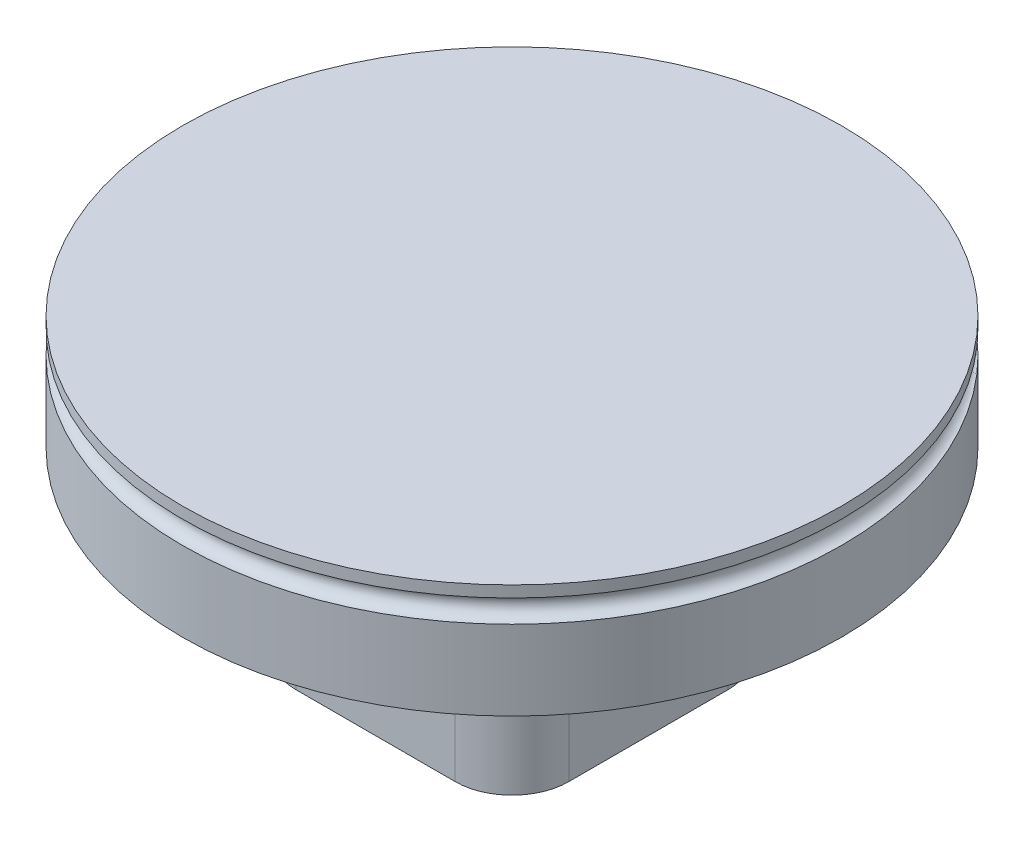
from build123d import *

# Parameters (mm, degrees)
SKETCH1_R           = 29
BOSS_EXTRUDE1_DEPTH = 10
SKETCH2_W           = 24
SKETCH2_H           = 24
SKETCH2_R           = 10
BOSS_EXTRUDE2_DEPTH = 16
SKETCH3_R           = 3
CUT_EXTRUDE1_DEPTH  = 53.706735812
FILLET1_R           = 5
FILLET2_R           = 2
SKETCH4_R           = 1


with BuildPart() as part:
    # Sketch1 → Boss-Extrude1 (new body)
    with BuildSketch(Plane(origin=(0, 0, 0), x_dir=(1, 0, 0), z_dir=(0, 1, 0))):
        Circle(SKETCH1_R)
    extrude(amount=BOSS_EXTRUDE1_DEPTH)

    # Sketch2 → Boss-Extrude2 (add)
    with BuildSketch(Plane.XZ):
        Rectangle(SKETCH2_W, SKETCH2_H)
        Circle(SKETCH2_R, mode=Mode.SUBTRACT)
    extrude(amount=BOSS_EXTRUDE2_DEPTH)

    # Sketch3 → Cut-Extrude1 (cut, through all)
    with BuildSketch(Plane(origin=(12, 0, 0), x_dir=(0, 0, -1), z_dir=(1, 0, 0))):
        with Locations((0, -8)):
            Circle(SKETCH3_R)
    extrude(amount=-CUT_EXTRUDE1_DEPTH, mode=Mode.SUBTRACT)

    # Fillet1
    fillet1_edges = [part.edges().sort_by_distance(p)[0] for p in [
        (-12, -8, -12),
        (12, -8, -12),
        (12, -8, 12),
        (-12, -8, 12),
    ]]
    fillet(fillet1_edges, radius=FILLET1_R)

    # Fillet2
    fillet2_edges = [part.edges().sort_by_distance(p)[0] for p in [
        (-10.535533906, 0, 10.535533906),
        (0, 0, 12),
        (10.535533906, 0, 10.535533906),
        (12, 0, 0),
        (10.535533906, 0, -10.535533906),
        (0, 0, -12),
        (-10.535533906, 0, -10.535533906),
        (-12, 0, 0),
    ]]
    fillet(fillet2_edges, radius=FILLET2_R)

    # Sketch4 → Cut-Revolve1 (revolve, cut)
    with BuildSketch(Plane.XY):
        with Locations((-29, 8)):
            Circle(SKETCH4_R)
    revolve(axis=Axis((0, 0, 0), (0, 1, 0)), mode=Mode.SUBTRACT)


solid = part.part
